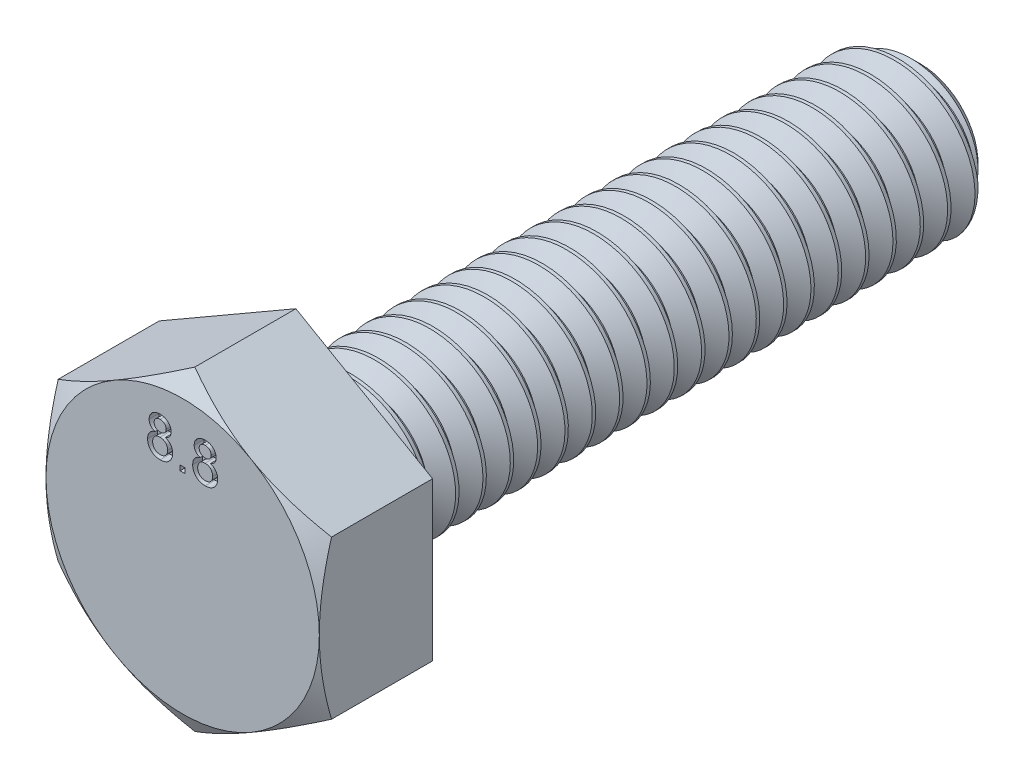
from build123d import *

# Parameters (mm, degrees)
BOSS_EXTRUDE1_DEPTH = 2.9
SKETCH4_OUTSIDE_W   = 47.984
SKETCH4_OUTSIDE_H   = 49.066
SKETCH4_OUTSIDE_R   = 3.5
CUT_EXTRUDE2_DEPTH  = 10
CUT_EXTRUDE2_DRAFT  = -60
SKETCH10_W          = 0.128205128
SKETCH10_H          = 0.128205128
CUT_EXTRUDE5_DEPTH  = 0.25
CUT_SWEEP1_PITCH    = 0.7
SKETCH9_OUTSIDE_W   = 15.444
SKETCH9_OUTSIDE_H   = 16.526
SKETCH9_OUTSIDE_R   = 1.46955944
CUT_EXTRUDE4_DEPTH  = 1.05
CUT_EXTRUDE4_DRAFT  = -45


with BuildPart() as part:
    # Sketch2 → Revolve1 (revolve)
    with BuildSketch(Plane(origin=(0, 0, 0), x_dir=(0, 0, -1), z_dir=(1, 0, 0))):
        Polygon((9.45, 0), (-9.45, 0), (-9.45, 3.5), (-6.55, 3.5), (-6.55, 2), (9.45, 2), align=None)
    revolve(axis=Axis((0, 0, -9.45), (0, 0, 1)))


with BuildPart() as body_2:
    # Sketch3 → Boss-Extrude1 (new body)
    with BuildSketch(Plane.XY.offset(9.45)):
        Polygon((0, 4.041451884), (-3.5, 2.020725942), (-3.5, -2.020725942), (0, -4.041451884), (3.5, -2.020725942), (3.5, 2.020725942), align=None)
    extrude(amount=-BOSS_EXTRUDE1_DEPTH)


with BuildPart() as cut_extrude2_tool:
    # Sketch4 outside → Cut-Extrude2 (with draft: the straight prism first)
    with BuildSketch(Plane.XY.offset(9.45)):
        Rectangle(SKETCH4_OUTSIDE_W, SKETCH4_OUTSIDE_H)
        with Locations(Location((0, 0, 0), (0, 0, 90))):
            Circle(SKETCH4_OUTSIDE_R, mode=Mode.SUBTRACT)
    extrude(amount=-CUT_EXTRUDE2_DEPTH)
    # Cut-Extrude2: the draft: its side faces are tilted about the plane it starts from
    cut_extrude2_sides = [cut_extrude2_tool.faces().sort_by_distance(p)[0] for p in [
        (0, -24.533, 4.45),
        (23.992, 0, 4.45),
        (0, 24.533, 4.45),
        (-23.992, 0, 4.45),
        (0, -3.5, 4.45),
    ]]
    draft(cut_extrude2_sides, Plane.XY.offset(9.45), CUT_EXTRUDE2_DRAFT)


with BuildPart() as body_2_1:
    add(body_2.part)

    # Cut-Extrude2: cut by cut_extrude2_tool
    add(cut_extrude2_tool.part, mode=Mode.SUBTRACT)


with BuildPart() as cut_extrude5_tool:
    # Sketch10 → Cut-Extrude5 (new body)
    # profile 1 of 3: a face of its own
    with BuildSketch(Plane.XY.offset(9.45)):
        with BuildLine():
            add(Edge.make_bspline(
                [(-0.707532051, 2.412899811), (-0.719696454, 2.417658594), (-0.743019648, 2.42678276), (-0.774476624, 2.445042783), (-0.801099925, 2.466048536), (-0.822562654, 2.490306557), (-0.838921155, 2.517315367), (-0.850699923, 2.546730606), (-0.857598954, 2.578716147), (-0.858506946, 2.600833325), (-0.858974359, 2.612218721)],
                knots=[0, 0, 0, 0, 1.16287356, 2.229614231, 3.228817875, 4.173350329, 5.100165549, 6.029633206, 6.985702163, 8, 8, 8, 8], degree=3))
            add(Edge.make_bspline(
                [(-0.858974359, 2.612218721), (-0.85875437, 2.620979281), (-0.858322523, 2.638176534), (-0.854591275, 2.663410592), (-0.848615143, 2.687591132), (-0.840133614, 2.710649908), (-0.829507648, 2.732776715), (-0.81609947, 2.753566178), (-0.800687603, 2.773605852), (-0.782633333, 2.792085671), (-0.76273784, 2.809011397), (-0.741187916, 2.82407363), (-0.717818661, 2.836390875), (-0.693019706, 2.84668913), (-0.666668434, 2.854751575), (-0.638672021, 2.860242549), (-0.609129161, 2.863735215), (-0.588885691, 2.86418967), (-0.578525641, 2.864422247)],
                knots=[0, 0, 0, 0, 0.994101948, 1.951453197, 2.889123786, 3.817215529, 4.736003873, 5.669743943, 6.620499649, 7.601567446, 8.596478358, 9.582687259, 10.579761808, 11.589151689, 12.62747492, 13.702346593, 14.8241243, 16, 16, 16, 16], degree=3))
            add(Edge.make_bspline(
                [(-0.578525641, 2.864422247), (-0.568099576, 2.864187308), (-0.547790777, 2.863729675), (-0.518090961, 2.860283936), (-0.489917873, 2.854508663), (-0.463288098, 2.846315004), (-0.438159655, 2.835838918), (-0.414697663, 2.822962433), (-0.392660593, 2.807897924), (-0.372611706, 2.79046574), (-0.35436961, 2.771540058), (-0.338564556, 2.751264246), (-0.325009064, 2.730111427), (-0.313807487, 2.707953092), (-0.305520518, 2.684536919), (-0.299203987, 2.660304077), (-0.295540106, 2.634966635), (-0.295097345, 2.617772543), (-0.294871795, 2.609013593)],
                knots=[0, 0, 0, 0, 1.171211919, 2.281388661, 3.353996503, 4.398126828, 5.406889753, 6.407389155, 7.400009931, 8.40008733, 9.387021643, 10.349004252, 11.283445052, 12.206096336, 13.131640667, 14.068727932, 15.016178647, 16, 16, 16, 16], degree=3))
            add(Edge.make_bspline(
                [(-0.294871795, 2.609013593), (-0.295238194, 2.598020602), (-0.295956633, 2.576465416), (-0.30327785, 2.545393436), (-0.314688593, 2.516386185), (-0.331180561, 2.489996492), (-0.352067024, 2.465951809), (-0.377985459, 2.445049502), (-0.408542247, 2.426818016), (-0.431276567, 2.417664099), (-0.443108974, 2.412899811)],
                knots=[0, 0, 0, 0, 0.998680737, 1.958225066, 2.887911823, 3.823713378, 4.77537694, 5.772726054, 6.840782926, 8, 8, 8, 8], degree=3))
            add(Edge.make_bspline(
                [(-0.443108974, 2.412899811), (-0.435643494, 2.410365634), (-0.42101439, 2.405399746), (-0.400333203, 2.395744531), (-0.380862487, 2.385333917), (-0.362492444, 2.374064421), (-0.345901159, 2.361097957), (-0.330535096, 2.34720118), (-0.316458863, 2.332178254), (-0.303864724, 2.315901411), (-0.292620724, 2.298712271), (-0.282994967, 2.280568928), (-0.274819996, 2.261729629), (-0.267833385, 2.242107011), (-0.262730218, 2.221562855), (-0.2591596, 2.200191573), (-0.256894143, 2.178105799), (-0.256573229, 2.163105624), (-0.256410256, 2.155487952)],
                knots=[0, 0, 0, 0, 1.104208047, 2.163768705, 3.193778962, 4.198696312, 5.179575955, 6.14024585, 7.100368562, 8.060719304, 9.021161243, 9.975749006, 10.935506756, 11.897452199, 12.89163552, 13.897859372, 14.932451246, 16, 16, 16, 16], degree=3))
            add(Edge.make_bspline(
                [(-0.256410256, 2.155487952), (-0.256665037, 2.144988736), (-0.257166973, 2.12430448), (-0.261577147, 2.093942421), (-0.268249934, 2.064775519), (-0.277979629, 2.036926988), (-0.290406866, 2.010377141), (-0.305779508, 1.98516453), (-0.323946515, 1.961315093), (-0.344371991, 1.938754696), (-0.36720766, 1.918361075), (-0.391911625, 1.900389795), (-0.418576577, 1.885336556), (-0.446878979, 1.872872529), (-0.476954353, 1.863212954), (-0.508764039, 1.856449203), (-0.542297453, 1.852421688), (-0.565226562, 1.851878714), (-0.576923077, 1.851601734)],
                knots=[0, 0, 0, 0, 1.017598406, 2.004746413, 2.969099523, 3.915171376, 4.859468899, 5.806714415, 6.772805022, 7.762836953, 8.753334612, 9.736396794, 10.719437652, 11.716790048, 12.730404696, 13.776887535, 14.865953843, 16, 16, 16, 16], degree=3))
            add(Edge.make_bspline(
                [(-0.576923077, 1.851601734), (-0.588618422, 1.851884683), (-0.611545238, 1.852439359), (-0.645109289, 1.856384538), (-0.676873464, 1.863454907), (-0.706909732, 1.873124301), (-0.735381032, 1.885250864), (-0.761866904, 1.90064329), (-0.786732234, 1.918591802), (-0.809583782, 1.939111563), (-0.830178921, 1.961669553), (-0.848106447, 1.98587121), (-0.86338783, 2.011344078), (-0.875964077, 2.038231754), (-0.885550045, 2.066534482), (-0.892277591, 2.096146005), (-0.896695747, 2.127043694), (-0.897185704, 2.148127235), (-0.897435897, 2.1588934)],
                knots=[0, 0, 0, 0, 1.127066097, 2.209429196, 3.250843736, 4.258219581, 5.246860502, 6.227045772, 7.204057202, 8.19754525, 9.181483529, 10.142920909, 11.095356922, 12.039670968, 12.998174893, 13.969127444, 14.962948905, 16, 16, 16, 16], degree=3))
            add(Edge.make_bspline(
                [(-0.897435897, 2.1588934), (-0.897261994, 2.166909612), (-0.896920766, 2.182638805), (-0.894836319, 2.205709252), (-0.890682055, 2.227697812), (-0.885331098, 2.248734065), (-0.878537058, 2.268870638), (-0.870155316, 2.287949397), (-0.859986104, 2.305924231), (-0.848433212, 2.322912103), (-0.835350856, 2.338793751), (-0.820951071, 2.353430095), (-0.80518155, 2.366654658), (-0.788396663, 2.378853688), (-0.769892846, 2.389164263), (-0.750358252, 2.398626136), (-0.729457028, 2.406695359), (-0.71491357, 2.410810947), (-0.707532051, 2.412899811)],
                knots=[0, 0, 0, 0, 1.117345089, 2.192424383, 3.22371675, 4.232639188, 5.215561493, 6.182180952, 7.132172269, 8.089790513, 9.041830748, 9.996006267, 10.94686322, 11.907506267, 12.882866327, 13.894317773, 14.931262935, 16, 16, 16, 16], degree=3))
        make_face()
        with BuildLine():
            add(Edge.make_bspline(
                [(-0.730769231, 2.611617759), (-0.730388719, 2.601411732), (-0.729653403, 2.58168916), (-0.721656754, 2.553674692), (-0.709152316, 2.528509843), (-0.694493058, 2.510260877), (-0.68043851, 2.497826913), (-0.668708055, 2.489525197), (-0.655888936, 2.482477207), (-0.641888284, 2.476999066), (-0.627045196, 2.472145773), (-0.610847755, 2.469433135), (-0.593676672, 2.467227922), (-0.581805902, 2.467068213), (-0.575721154, 2.466986349)],
                knots=[0, 0, 0, 0, 1.528727296, 2.954179336, 4.335216052, 5.725683216, 6.435919001, 7.148062981, 7.879427438, 8.626027458, 9.402978632, 10.2190538, 11.08711833, 12, 12, 12, 12], degree=3))
            add(Edge.make_bspline(
                [(-0.575721154, 2.466986349), (-0.569770721, 2.467071238), (-0.558167703, 2.467236767), (-0.541383354, 2.469397023), (-0.525522202, 2.472282247), (-0.510818629, 2.476654361), (-0.497102884, 2.482339385), (-0.484598046, 2.489347615), (-0.472929911, 2.497402084), (-0.459288234, 2.509931043), (-0.444649204, 2.527540858), (-0.432102861, 2.551581557), (-0.424284514, 2.577883509), (-0.42348652, 2.596204353), (-0.423076923, 2.605608144)],
                knots=[0, 0, 0, 0, 0.922112375, 1.798068639, 2.620552757, 3.419964248, 4.17189205, 4.918165909, 5.639229138, 6.36503528, 7.785020832, 9.165298717, 10.544993853, 12, 12, 12, 12], degree=3))
            add(Edge.make_bspline(
                [(-0.423076923, 2.605608144), (-0.42357043, 2.615340665), (-0.424536096, 2.634384689), (-0.432335346, 2.661723244), (-0.445466065, 2.68648381), (-0.460466091, 2.704566101), (-0.474349088, 2.717665656), (-0.486226701, 2.7260044), (-0.498995178, 2.733101409), (-0.512703118, 2.738897072), (-0.527370342, 2.743571334), (-0.543036582, 2.746637876), (-0.559636009, 2.748788549), (-0.571039473, 2.748952857), (-0.576923077, 2.749037631)],
                knots=[0, 0, 0, 0, 1.480633456, 2.897216237, 4.289382554, 5.720567045, 6.454675042, 7.191244726, 7.924224627, 8.676083236, 9.454506446, 10.26432127, 11.104478565, 12, 12, 12, 12], degree=3))
            add(Edge.make_bspline(
                [(-0.576923077, 2.749037631), (-0.582807336, 2.748955599), (-0.594278411, 2.74879568), (-0.610986078, 2.746580469), (-0.626800787, 2.743798209), (-0.641576637, 2.739333197), (-0.655252211, 2.733498464), (-0.667970349, 2.726397469), (-0.679825456, 2.718271725), (-0.693805991, 2.7057563), (-0.708448299, 2.688146087), (-0.72134776, 2.664489346), (-0.729320044, 2.638695514), (-0.730280185, 2.620755473), (-0.730769231, 2.611617759)],
                knots=[0, 0, 0, 0, 0.914830409, 1.783417199, 2.618873138, 3.411020283, 4.179090249, 4.927874451, 5.674348476, 6.410336976, 7.841713217, 9.213201474, 10.580551314, 12, 12, 12, 12], degree=3))
        make_face(mode=Mode.SUBTRACT)
        with BuildLine():
            add(Edge.make_bspline(
                [(-0.769230769, 2.161297247), (-0.769009074, 2.153070903), (-0.768565098, 2.136596547), (-0.764670481, 2.112128638), (-0.758062121, 2.088116365), (-0.749592358, 2.064537049), (-0.73764523, 2.042342391), (-0.721801995, 2.022532025), (-0.701921702, 2.005876665), (-0.67921732, 1.991805584), (-0.654441003, 1.980730433), (-0.628623355, 1.972999601), (-0.602430718, 1.967891454), (-0.5847589, 1.967288085), (-0.575921474, 1.966986349)],
                knots=[0, 0, 0, 0, 0.957879255, 1.91828174, 2.876792425, 3.856375228, 4.831004356, 5.799187063, 6.79220414, 7.836856316, 8.902268238, 9.943090861, 10.971368942, 12, 12, 12, 12], degree=3))
            add(Edge.make_bspline(
                [(-0.575921474, 1.966986349), (-0.568634064, 1.967109793), (-0.554476703, 1.967349608), (-0.533839704, 1.970090012), (-0.514394985, 1.974248103), (-0.496053462, 1.979949526), (-0.4790851, 1.98774945), (-0.463213577, 1.996865868), (-0.448601239, 2.007883756), (-0.435252222, 2.020457948), (-0.423302486, 2.03436736), (-0.413066025, 2.049372577), (-0.40413664, 2.065051613), (-0.396846205, 2.081742847), (-0.391574045, 2.099480696), (-0.38750583, 2.117945132), (-0.385051595, 2.137326606), (-0.384762896, 2.150539645), (-0.384615385, 2.157290836)],
                knots=[0, 0, 0, 0, 1.149387474, 2.232932207, 3.278773642, 4.285224938, 5.256757121, 6.220082341, 7.168479488, 8.137608443, 9.109140627, 10.056190326, 10.999892409, 11.953252726, 12.923240661, 13.915357002, 14.934853301, 16, 16, 16, 16], degree=3))
            add(Edge.make_bspline(
                [(-0.384615385, 2.157290836), (-0.384767593, 2.164174546), (-0.385065594, 2.177651753), (-0.387457458, 2.19745861), (-0.391753793, 2.2162479), (-0.397278898, 2.234303476), (-0.404766995, 2.251311221), (-0.413755407, 2.267515008), (-0.42476256, 2.282487739), (-0.436832781, 2.296737742), (-0.45049223, 2.309637288), (-0.465576536, 2.320761054), (-0.481607645, 2.330585223), (-0.499070511, 2.338121191), (-0.517580405, 2.344157672), (-0.537225263, 2.348543872), (-0.558085183, 2.351225039), (-0.572374136, 2.351473744), (-0.579727564, 2.351601734)],
                knots=[0, 0, 0, 0, 1.065858887, 2.086781919, 3.082735321, 4.047496077, 5.006086125, 5.955204095, 6.910833714, 7.878747924, 8.844339535, 9.812198509, 10.776903849, 11.749116737, 12.749729282, 13.788304076, 14.861809717, 16, 16, 16, 16], degree=3))
            add(Edge.make_bspline(
                [(-0.579727564, 2.351601734), (-0.586881305, 2.35147247), (-0.600904865, 2.351219074), (-0.621277221, 2.34852272), (-0.640563584, 2.344382013), (-0.65859427, 2.338321539), (-0.675594719, 2.330748359), (-0.691253999, 2.321225628), (-0.70585147, 2.310172455), (-0.718941232, 2.297325243), (-0.73075159, 2.283369678), (-0.740962908, 2.268409356), (-0.749983574, 2.25279131), (-0.756829166, 2.236003057), (-0.762623347, 2.218587328), (-0.766245627, 2.200206105), (-0.768820615, 2.181068229), (-0.769092053, 2.167983898), (-0.769230769, 2.161297247)],
                knots=[0, 0, 0, 0, 1.135239447, 2.225422834, 3.256957183, 4.262780498, 5.240265059, 6.205773948, 7.16638056, 8.141101257, 9.111719309, 10.064571387, 11.014055337, 11.969087385, 12.938082716, 13.92369833, 14.938921288, 16, 16, 16, 16], degree=3))
        make_face(mode=Mode.SUBTRACT)
    # profile 2 of 3: a face of its own
    with BuildSketch(Plane.XY.offset(9.45)):
        with Locations((0, 1.928524811)):
            Rectangle(SKETCH10_W, SKETCH10_H)
    # profile 3 of 3: a face of its own
    with BuildSketch(Plane.XY.offset(9.45)):
        with BuildLine():
            add(Edge.make_bspline(
                [(0.446314103, 2.412899811), (0.4341497, 2.417658594), (0.410826506, 2.42678276), (0.37936953, 2.445042783), (0.352746228, 2.466048536), (0.3312835, 2.490306557), (0.314924998, 2.517315367), (0.303146231, 2.546730606), (0.2962472, 2.578716147), (0.295339208, 2.600833325), (0.294871795, 2.612218721)],
                knots=[0, 0, 0, 0, 1.16287356, 2.229614231, 3.228817875, 4.173350329, 5.100165549, 6.029633206, 6.985702163, 8, 8, 8, 8], degree=3))
            add(Edge.make_bspline(
                [(0.294871795, 2.612218721), (0.295091784, 2.620979281), (0.29552363, 2.638176534), (0.299254879, 2.663410592), (0.305231011, 2.687591132), (0.31371254, 2.710649908), (0.324338506, 2.732776715), (0.337746683, 2.753566178), (0.353158551, 2.773605852), (0.371212821, 2.792085671), (0.391108314, 2.809011397), (0.412658238, 2.82407363), (0.436027493, 2.836390875), (0.460826448, 2.84668913), (0.48717772, 2.854751575), (0.515174133, 2.860242549), (0.544716993, 2.863735215), (0.564960463, 2.86418967), (0.575320513, 2.864422247)],
                knots=[0, 0, 0, 0, 0.994101948, 1.951453197, 2.889123786, 3.817215529, 4.736003873, 5.669743943, 6.620499649, 7.601567446, 8.596478358, 9.582687259, 10.579761808, 11.589151689, 12.62747492, 13.702346593, 14.8241243, 16, 16, 16, 16], degree=3))
            add(Edge.make_bspline(
                [(0.575320513, 2.864422247), (0.585746578, 2.864187308), (0.606055377, 2.863729675), (0.635755192, 2.860283936), (0.663928281, 2.854508663), (0.690558055, 2.846315004), (0.715686498, 2.835838918), (0.739148491, 2.822962433), (0.761185561, 2.807897924), (0.781234447, 2.79046574), (0.799476544, 2.771540058), (0.815281598, 2.751264246), (0.82883709, 2.730111427), (0.840038667, 2.707953092), (0.848325636, 2.684536919), (0.854642167, 2.660304077), (0.858306048, 2.634966635), (0.858748809, 2.617772543), (0.858974359, 2.609013593)],
                knots=[0, 0, 0, 0, 1.171211919, 2.281388661, 3.353996503, 4.398126828, 5.406889753, 6.407389155, 7.400009931, 8.40008733, 9.387021643, 10.349004252, 11.283445052, 12.206096336, 13.131640667, 14.068727932, 15.016178647, 16, 16, 16, 16], degree=3))
            add(Edge.make_bspline(
                [(0.858974359, 2.609013593), (0.85860796, 2.598020602), (0.857889521, 2.576465416), (0.850568304, 2.545393436), (0.83915756, 2.516386185), (0.822665593, 2.489996492), (0.80177913, 2.465951809), (0.775860695, 2.445049502), (0.745303907, 2.426818016), (0.722569587, 2.417664099), (0.710737179, 2.412899811)],
                knots=[0, 0, 0, 0, 0.998680737, 1.958225066, 2.887911823, 3.823713378, 4.77537694, 5.772726054, 6.840782926, 8, 8, 8, 8], degree=3))
            add(Edge.make_bspline(
                [(0.710737179, 2.412899811), (0.71820266, 2.410365634), (0.732831763, 2.405399746), (0.753512951, 2.395744531), (0.772983667, 2.385333917), (0.791353709, 2.374064421), (0.807944995, 2.361097957), (0.823311058, 2.34720118), (0.837387291, 2.332178254), (0.84998143, 2.315901411), (0.86122543, 2.298712271), (0.870851187, 2.280568928), (0.879026158, 2.261729629), (0.886012769, 2.242107011), (0.891115936, 2.221562855), (0.894686554, 2.200191573), (0.89695201, 2.178105799), (0.897272925, 2.163105624), (0.897435897, 2.155487952)],
                knots=[0, 0, 0, 0, 1.104208047, 2.163768705, 3.193778962, 4.198696312, 5.179575955, 6.14024585, 7.100368562, 8.060719304, 9.021161243, 9.975749006, 10.935506756, 11.897452199, 12.89163552, 13.897859372, 14.932451246, 16, 16, 16, 16], degree=3))
            add(Edge.make_bspline(
                [(0.897435897, 2.155487952), (0.897181117, 2.144988736), (0.89667918, 2.12430448), (0.892269007, 2.093942421), (0.88559622, 2.064775519), (0.875866525, 2.036926988), (0.863439288, 2.010377141), (0.848066645, 1.98516453), (0.829899639, 1.961315093), (0.809474163, 1.938754696), (0.786638494, 1.918361075), (0.761934529, 1.900389795), (0.735269577, 1.885336556), (0.706967175, 1.872872529), (0.676891801, 1.863212954), (0.645082115, 1.856449203), (0.611548701, 1.852421688), (0.588619592, 1.851878714), (0.576923077, 1.851601734)],
                knots=[0, 0, 0, 0, 1.017598406, 2.004746413, 2.969099523, 3.915171376, 4.859468899, 5.806714415, 6.772805022, 7.762836953, 8.753334612, 9.736396794, 10.719437652, 11.716790048, 12.730404696, 13.776887535, 14.865953843, 16, 16, 16, 16], degree=3))
            add(Edge.make_bspline(
                [(0.576923077, 1.851601734), (0.565227732, 1.851884683), (0.542300916, 1.852439359), (0.508736865, 1.856384538), (0.47697269, 1.863454907), (0.446936421, 1.873124301), (0.418465122, 1.885250864), (0.39197925, 1.90064329), (0.36711392, 1.918591802), (0.344262372, 1.939111563), (0.323667232, 1.961669553), (0.305739707, 1.98587121), (0.290458324, 2.011344078), (0.277882077, 2.038231754), (0.268296109, 2.066534482), (0.261568563, 2.096146005), (0.257150407, 2.127043694), (0.25666045, 2.148127235), (0.256410256, 2.1588934)],
                knots=[0, 0, 0, 0, 1.127066097, 2.209429196, 3.250843736, 4.258219581, 5.246860502, 6.227045772, 7.204057202, 8.19754525, 9.181483529, 10.142920909, 11.095356922, 12.039670968, 12.998174893, 13.969127444, 14.962948905, 16, 16, 16, 16], degree=3))
            add(Edge.make_bspline(
                [(0.256410256, 2.1588934), (0.25658416, 2.166909612), (0.256925388, 2.182638805), (0.259009835, 2.205709252), (0.263164099, 2.227697812), (0.268515055, 2.248734065), (0.275309096, 2.268870638), (0.283690837, 2.287949397), (0.29386005, 2.305924231), (0.305412942, 2.322912103), (0.318495297, 2.338793751), (0.332895082, 2.353430095), (0.348664603, 2.366654658), (0.365449491, 2.378853688), (0.383953308, 2.389164263), (0.403487902, 2.398626136), (0.424389126, 2.406695359), (0.438932584, 2.410810947), (0.446314103, 2.412899811)],
                knots=[0, 0, 0, 0, 1.117345089, 2.192424383, 3.22371675, 4.232639188, 5.215561493, 6.182180952, 7.132172269, 8.089790513, 9.041830748, 9.996006267, 10.94686322, 11.907506267, 12.882866327, 13.894317773, 14.931262935, 16, 16, 16, 16], degree=3))
        make_face()
        with BuildLine():
            add(Edge.make_bspline(
                [(0.423076923, 2.611617759), (0.423457434, 2.601411732), (0.424192751, 2.58168916), (0.4321894, 2.553674692), (0.444693837, 2.528509843), (0.459353096, 2.510260877), (0.473407644, 2.497826913), (0.485138099, 2.489525197), (0.497957218, 2.482477207), (0.51195787, 2.476999066), (0.526800958, 2.472145773), (0.542998399, 2.469433135), (0.560169482, 2.467227922), (0.572040252, 2.467068213), (0.578125, 2.466986349)],
                knots=[0, 0, 0, 0, 1.528727296, 2.954179336, 4.335216052, 5.725683216, 6.435919001, 7.148062981, 7.879427438, 8.626027458, 9.402978632, 10.2190538, 11.08711833, 12, 12, 12, 12], degree=3))
            add(Edge.make_bspline(
                [(0.578125, 2.466986349), (0.584075433, 2.467071238), (0.595678451, 2.467236767), (0.6124628, 2.469397023), (0.628323952, 2.472282247), (0.643027524, 2.476654361), (0.65674327, 2.482339385), (0.669248108, 2.489347615), (0.680916243, 2.497402084), (0.69455792, 2.509931043), (0.709196949, 2.527540858), (0.721743292, 2.551581557), (0.729561639, 2.577883509), (0.730359633, 2.596204353), (0.730769231, 2.605608144)],
                knots=[0, 0, 0, 0, 0.922112375, 1.798068639, 2.620552757, 3.419964248, 4.17189205, 4.918165909, 5.639229138, 6.36503528, 7.785020832, 9.165298717, 10.544993853, 12, 12, 12, 12], degree=3))
            add(Edge.make_bspline(
                [(0.730769231, 2.605608144), (0.730275723, 2.615340665), (0.729310058, 2.634384689), (0.721510808, 2.661723244), (0.708380089, 2.68648381), (0.693380063, 2.704566101), (0.679497066, 2.717665656), (0.667619453, 2.7260044), (0.654850976, 2.733101409), (0.641143036, 2.738897072), (0.626475812, 2.743571334), (0.610809572, 2.746637876), (0.594210145, 2.748788549), (0.582806681, 2.748952857), (0.576923077, 2.749037631)],
                knots=[0, 0, 0, 0, 1.480633456, 2.897216237, 4.289382554, 5.720567045, 6.454675042, 7.191244726, 7.924224627, 8.676083236, 9.454506446, 10.26432127, 11.104478565, 12, 12, 12, 12], degree=3))
            add(Edge.make_bspline(
                [(0.576923077, 2.749037631), (0.571038818, 2.748955599), (0.559567743, 2.74879568), (0.542860076, 2.746580469), (0.527045367, 2.743798209), (0.512269516, 2.739333197), (0.498593943, 2.733498464), (0.485875805, 2.726397469), (0.474020698, 2.718271725), (0.460040163, 2.7057563), (0.445397855, 2.688146087), (0.432498394, 2.664489346), (0.42452611, 2.638695514), (0.423565969, 2.620755473), (0.423076923, 2.611617759)],
                knots=[0, 0, 0, 0, 0.914830409, 1.783417199, 2.618873138, 3.411020283, 4.179090249, 4.927874451, 5.674348476, 6.410336976, 7.841713217, 9.213201474, 10.580551314, 12, 12, 12, 12], degree=3))
        make_face(mode=Mode.SUBTRACT)
        with BuildLine():
            add(Edge.make_bspline(
                [(0.384615385, 2.161297247), (0.38483708, 2.153070903), (0.385281055, 2.136596547), (0.389175673, 2.112128638), (0.395784033, 2.088116365), (0.404253796, 2.064537049), (0.416200924, 2.042342391), (0.432044159, 2.022532025), (0.451924452, 2.005876665), (0.474628834, 1.991805584), (0.499405151, 1.980730433), (0.525222799, 1.972999601), (0.551415436, 1.967891454), (0.569087254, 1.967288085), (0.577924679, 1.966986349)],
                knots=[0, 0, 0, 0, 0.957879255, 1.91828174, 2.876792425, 3.856375228, 4.831004356, 5.799187063, 6.79220414, 7.836856316, 8.902268238, 9.943090861, 10.971368942, 12, 12, 12, 12], degree=3))
            add(Edge.make_bspline(
                [(0.577924679, 1.966986349), (0.58521209, 1.967109793), (0.59936945, 1.967349608), (0.62000645, 1.970090012), (0.639451168, 1.974248103), (0.657792692, 1.979949526), (0.674761054, 1.98774945), (0.690632576, 1.996865868), (0.705244914, 2.007883756), (0.718593931, 2.020457948), (0.730543668, 2.03436736), (0.740780129, 2.049372577), (0.749709514, 2.065051613), (0.756999949, 2.081742847), (0.762272109, 2.099480696), (0.766340324, 2.117945132), (0.768794558, 2.137326606), (0.769083258, 2.150539645), (0.769230769, 2.157290836)],
                knots=[0, 0, 0, 0, 1.149387474, 2.232932207, 3.278773642, 4.285224938, 5.256757121, 6.220082341, 7.168479488, 8.137608443, 9.109140627, 10.056190326, 10.999892409, 11.953252726, 12.923240661, 13.915357002, 14.934853301, 16, 16, 16, 16], degree=3))
            add(Edge.make_bspline(
                [(0.769230769, 2.157290836), (0.76907856, 2.164174546), (0.76878056, 2.177651753), (0.766388696, 2.19745861), (0.76209236, 2.2162479), (0.756567256, 2.234303476), (0.749079159, 2.251311221), (0.740090747, 2.267515008), (0.729083594, 2.282487739), (0.717013372, 2.296737742), (0.703353924, 2.309637288), (0.688269617, 2.320761054), (0.672238509, 2.330585223), (0.654775642, 2.338121191), (0.636265749, 2.344157672), (0.616620891, 2.348543872), (0.595760971, 2.351225039), (0.581472018, 2.351473744), (0.57411859, 2.351601734)],
                knots=[0, 0, 0, 0, 1.065858887, 2.086781919, 3.082735321, 4.047496077, 5.006086125, 5.955204095, 6.910833714, 7.878747924, 8.844339535, 9.812198509, 10.776903849, 11.749116737, 12.749729282, 13.788304076, 14.861809717, 16, 16, 16, 16], degree=3))
            add(Edge.make_bspline(
                [(0.57411859, 2.351601734), (0.566964849, 2.35147247), (0.552941289, 2.351219074), (0.532568933, 2.34852272), (0.51328257, 2.344382013), (0.495251884, 2.338321539), (0.478251435, 2.330748359), (0.462592155, 2.321225628), (0.447994684, 2.310172455), (0.434904922, 2.297325243), (0.423094564, 2.283369678), (0.412883246, 2.268409356), (0.40386258, 2.25279131), (0.397016988, 2.236003057), (0.391222807, 2.218587328), (0.387600527, 2.200206105), (0.385025539, 2.181068229), (0.384754101, 2.167983898), (0.384615385, 2.161297247)],
                knots=[0, 0, 0, 0, 1.135239447, 2.225422834, 3.256957183, 4.262780498, 5.240265059, 6.205773948, 7.16638056, 8.141101257, 9.111719309, 10.064571387, 11.014055337, 11.969087385, 12.938082716, 13.92369833, 14.938921288, 16, 16, 16, 16], degree=3))
        make_face(mode=Mode.SUBTRACT)
    extrude(amount=-CUT_EXTRUDE5_DEPTH)


with BuildPart() as part_1:
    add(part.part)

    # Cut-Extrude5: cut by cut_extrude5_tool
    add(cut_extrude5_tool.part, mode=Mode.SUBTRACT)

    # Cut-Sweep1: arcs per turn and ends read off the stored shape
    # Cut-Sweep1: the profile of Sketch7 screwed along a right-hand helix through 24.857147 turns, 6 arcs to a turn; built about Z, then put on its axis
    cut_sweep1_z = Axis((0, 0, 0), (0, 0, 1))
    cut_sweep1_corners = [(1.545336663, 0, -0.9625), (1.545336663, 0, -1.05), (2.037888611, 0, -1.334375), (2.037888611, 0, -0.678125)]
    with BuildLine(mode=Mode.PRIVATE) as cut_sweep1_profile:
        Line(cut_sweep1_corners[0], cut_sweep1_corners[1])
        Line(cut_sweep1_corners[1], cut_sweep1_corners[2])
        Line(cut_sweep1_corners[2], cut_sweep1_corners[3])
        Line(cut_sweep1_corners[3], cut_sweep1_corners[0])
    cut_sweep1_cap = Face(cut_sweep1_profile.wire())
    cut_sweep1_turn_angles = [0, 30, 60, 90, 120, 150, 180, 210, 240, 270, 300, 330, 360]
    cut_sweep1_turn_weights = [1, 0.8660254037844387, 1, 0.8660254037844387, 1, 0.8660254037844387, 1, 0.8660254037844387, 1, 0.8660254037844387, 1, 0.8660254037844387, 1]
    cut_sweep1_turn_rails = [Edge.make_bspline([Vector(p[0], p[1], 0).rotate(cut_sweep1_z, cut_sweep1_turn_angles[k]) / cut_sweep1_turn_weights[k] + Vector(0, 0, p[2] + CUT_SWEEP1_PITCH * cut_sweep1_turn_angles[k] / 360) for k in range(13)], [0, 0, 0, 1, 1, 2, 2, 3, 3, 4, 4, 5, 5, 6, 6, 6], 2, cut_sweep1_turn_weights) for p in cut_sweep1_corners]
    cut_sweep1_turn_sides = [Face.make_surface_from_curves(cut_sweep1_turn_rails[p[0]], cut_sweep1_turn_rails[p[1]]) for p in [(0, 1), (1, 2), (2, 3), (3, 0)]]
    cut_sweep1_last_angles = [8640, 8670, 8700, 8730, 8760, 8790, 8820, 8850, 8880, 8910, 8940, 8944.2865, 8948.573]
    cut_sweep1_last_weights = [1, 0.8660254037844387, 1, 0.8660254037844387, 1, 0.8660254037844387, 1, 0.8660254037844387, 1, 0.8660254037844387, 1, 0.9972027722911286, 1]
    cut_sweep1_last_rails = [Edge.make_bspline([Vector(p[0], p[1], 0).rotate(cut_sweep1_z, cut_sweep1_last_angles[k]) / cut_sweep1_last_weights[k] + Vector(0, 0, p[2] + CUT_SWEEP1_PITCH * cut_sweep1_last_angles[k] / 360) for k in range(13)], [0, 0, 0, 1, 1, 2, 2, 3, 3, 4, 4, 5, 5, 6, 6, 6], 2, cut_sweep1_last_weights) for p in cut_sweep1_corners]
    cut_sweep1_last_sides = [Face.make_surface_from_curves(cut_sweep1_last_rails[p[0]], cut_sweep1_last_rails[p[1]]) for p in [(0, 1), (1, 2), (2, 3), (3, 0)]]
    cut_sweep1 = Plane(origin=(0, 0, -9.45), x_dir=(0, 1, 0), z_dir=(0, 0, 1)) * Solid(Shell([*[p.moved(Location((0, 0, CUT_SWEEP1_PITCH * i))) for i in range(24) for p in cut_sweep1_turn_sides], *cut_sweep1_last_sides, cut_sweep1_cap, cut_sweep1_cap.rotate(cut_sweep1_z, 8948.573).moved(Location((0, 0, CUT_SWEEP1_PITCH * 8948.573 / 360)))]))
    add(cut_sweep1, mode=Mode.SUBTRACT)

    # Sketch8 → Revolve2 (revolve)
    with BuildSketch(Plane(origin=(0, 0, 0), x_dir=(0, 0, -1), z_dir=(1, 0, 0))):
        Polygon((-6.55, 2), (-5.85, 1.533333333), (-6.55, 1.533333333), align=None)
    revolve(axis=Axis((0, 0, -9.45), (0, 0, 1)))


with BuildPart() as body_2_2:
    add(body_2_1.part)

    # Cut-Extrude5: cut by cut_extrude5_tool
    add(cut_extrude5_tool.part, mode=Mode.SUBTRACT)


with BuildPart() as cut_extrude4_tool:
    # Sketch9 outside → Cut-Extrude4 (with draft: the straight prism first)
    with BuildSketch(Plane(origin=(0, 0, -9.45), x_dir=(-1, 0, 0), z_dir=(0, 0, -1))):
        Rectangle(SKETCH9_OUTSIDE_W, SKETCH9_OUTSIDE_H)
        Circle(SKETCH9_OUTSIDE_R, mode=Mode.SUBTRACT)
    extrude(amount=-CUT_EXTRUDE4_DEPTH)
    # Cut-Extrude4: the draft: its side faces are tilted about the plane it starts from
    cut_extrude4_sides = [cut_extrude4_tool.faces().sort_by_distance(p)[0] for p in [
        (0, -8.263, -8.925),
        (-7.722, 0, -8.925),
        (0, 8.263, -8.925),
        (7.722, 0, -8.925),
        (1.46955944, 0, -8.925),
    ]]
    draft(cut_extrude4_sides, Plane(origin=(0, 0, -9.45), x_dir=(-1, 0, 0), z_dir=(0, 0, -1)), CUT_EXTRUDE4_DRAFT)


with BuildPart() as part_2:
    add(part_1.part)

    # Cut-Extrude4: cut by cut_extrude4_tool
    add(cut_extrude4_tool.part, mode=Mode.SUBTRACT)

    # Combine1: union body 2
    add(body_2_2.part)


solid = part_2.part
